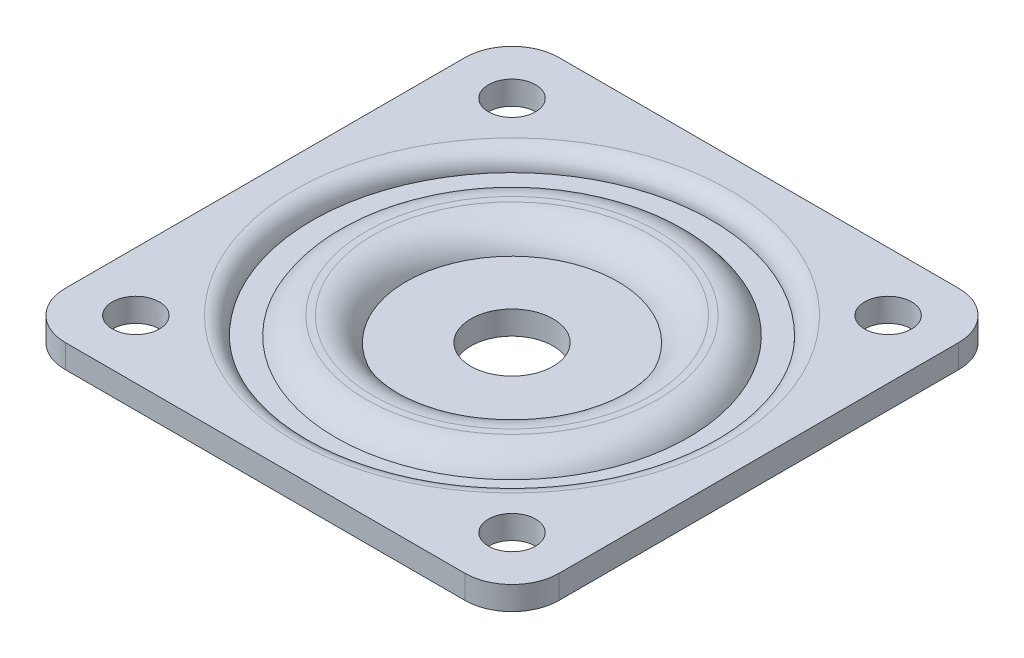
from build123d import *

# Parameters (mm, degrees)
ESBO_O9_W                  = 42
ESBO_O9_H                  = 42
RESSALTO_EXTRUS_O1_DEPTH   = 4
ESBO_O10_R                 = 17
ESBO_O10_R_2               = 15
CORTE_EXTRUS_O1_DEPTH      = 1.5
FILETE1_R                  = 1.5
CORTE_EXTRUS_O2_START      = -2
ESBO_O11_W                 = 42
ESBO_O11_H                 = 42
ESBO_O11_R                 = 17
CORTE_EXTRUS_O2_DEPTH      = 2
FILETE2_R                  = 2
ESBO_O12_R                 = 9
CORTE_EXTRUS_O3_DEPTH      = 2
FILETE3_R                  = 3
ESBO_O13_R                 = 14
ESBO_O13_R_2               = 12
CORTE_EXTRUS_O4_DEPTH      = 2
FILETE4_R                  = 2
ESBO_O14_R                 = 3.5
CORTE_EXTRUS_O5_DEPTH      = 30.765752132
FURO_DE_DI_METRO_5_0_5_1_D = 4
FILETE5_R                  = 4


# Some blends are built 0.0001 mm under size
with BuildPart() as part:
    # Esboço9 → Ressalto-extrusão1 (new body)
    with BuildSketch(Plane(origin=(0, 0, 0), x_dir=(1, 0, 0), z_dir=(0, 1, 0))):
        Rectangle(ESBO_O9_W, ESBO_O9_H)
    extrude(amount=RESSALTO_EXTRUS_O1_DEPTH)

    # Esboço10 → Corte-extrusão1 (cut)
    with BuildSketch(Plane(origin=(0, 4, 0), x_dir=(1, 0, 0), z_dir=(0, 1, 0))):
        with Locations(Location((0, 0, 0), (0, 0, 270))):
            Circle(ESBO_O10_R)
        with Locations(Location((0, 0, 0), (0, 0, 270))):
            Circle(ESBO_O10_R_2, mode=Mode.SUBTRACT)
    extrude(amount=-CORTE_EXTRUS_O1_DEPTH, mode=Mode.SUBTRACT)

    # Filete1
    filete1_edges = [part.edges().sort_by_distance(p)[0] for p in [
        (0, 4, -17),
    ]]
    fillet(filete1_edges, radius=FILETE1_R - 0.0001)  # a hair under: the kernel refuses the full size

    # Esboço11 → Corte-extrusão2 (cut)
    with BuildSketch(Plane.XZ.offset(CORTE_EXTRUS_O2_START)):
        Rectangle(ESBO_O11_W, ESBO_O11_H)
        with Locations(Location((0, 0, 0), (0, 0, 270))):
            Circle(ESBO_O11_R, mode=Mode.SUBTRACT)
    extrude(amount=CORTE_EXTRUS_O2_DEPTH, mode=Mode.SUBTRACT)

    # Filete2
    filete2_edges = [part.edges().sort_by_distance(p)[0] for p in [
        (0, 0, 17),
    ]]
    fillet(filete2_edges, radius=FILETE2_R - 0.0001)  # a hair under: the kernel refuses the full size

    # Esboço12 → Corte-extrusão3 (cut)
    with BuildSketch(Plane(origin=(0, 4, 0), x_dir=(1, 0, 0), z_dir=(0, 1, 0))):
        with Locations(Location((0, 0, 0), (0, 0, 270))):
            Circle(ESBO_O12_R)
    extrude(amount=-CORTE_EXTRUS_O3_DEPTH, mode=Mode.SUBTRACT)

    # Filete3
    # the kernel refuses this fillet: 3 mm, written as the material it takes off along each edge
    with BuildSketch(Plane(origin=(0, 4, 0), x_dir=(0, 0, 1), z_dir=(-1, 0, 0))) as filete3_piece_1:
        with BuildLine():
            CenterArc((12.401923789, -3), FILETE3_R, 30, 60)
            Line((12.401923789, 0), (12.401923789, 0.06))
            Line((12.401923789, 0.06), (15, 0.06))
            Line((15, 0.06), (15.06, 0))
            ThreePointArc((15.06, 0), (15.06, -0.75), (15.051961524, -1.47))
            Line((15.051961524, -1.47), (15, -1.5))
        make_face()
    revolve(axis=Axis((0, 4, 0), (0, 1, 0)), mode=Mode.SUBTRACT)
    with BuildSketch(Plane(origin=(0, 4, 0), x_dir=(0, 0, 1), z_dir=(-1, 0, 0))) as filete3_piece_2:
        with BuildLine():
            CenterArc((11.828427125, -3), FILETE3_R, 90, 70.528779366)
            Line((9, -2), (8.943431458, -1.98))
            ThreePointArc((8.943431458, -1.98), (8.94, -1), (8.94, 0))
            Line((8.94, 0), (9, 0.06))
            Line((9, 0.06), (11.828427125, 0.06))
            Line((11.828427125, 0.06), (11.828427125, 0))
        make_face()
    revolve(axis=Axis((0, 4, 0), (0, 1, 0)), mode=Mode.SUBTRACT)

    # Esboço13 → Corte-extrusão4 (cut)
    with BuildSketch(Plane.XZ):
        with Locations(Location((0, 0, 0), (0, 0, 270))):
            Circle(ESBO_O13_R)
        with Locations(Location((0, 0, 0), (0, 0, 270))):
            Circle(ESBO_O13_R_2, mode=Mode.SUBTRACT)
    extrude(amount=-CORTE_EXTRUS_O4_DEPTH, mode=Mode.SUBTRACT)

    # Filete4
    # the kernel refuses this fillet: 2 mm, written as the material it takes off along each edge
    with BuildSketch(Plane(origin=(0, 0, 0), x_dir=(0, 0, -1), z_dir=(-1, 0, 0))) as filete4_piece_1:
        with BuildLine():
            CenterArc((16, -1.732108539), FILETE4_R, 119.996692082, 60.003307918)
            Line((14, -1.732108539), (13.96, -1.732108539))
            Line((13.96, -1.732108539), (13.96, 0))
            Line((13.96, 0), (14, 0.04))
            ThreePointArc((14, 0.04), (14.50005, 0.04), (14.980102, 0.034642171))
            Line((14.980102, 0.034642171), (15.0001, 0))
        make_face()
    revolve(axis=Axis((0, 0, 0), (0, -1, 0)), mode=Mode.SUBTRACT)
    with BuildSketch(Plane(origin=(0, 0, 0), x_dir=(0, 0, -1), z_dir=(-1, 0, 0))) as filete4_piece_2:
        with BuildLine():
            CenterArc((12 - FILETE4_R, -FILETE4_R), FILETE4_R, 0, 90)
            Line((12 - FILETE4_R, 0), (12 - FILETE4_R, FILETE4_R * 0.02))
            Line((12 - FILETE4_R, FILETE4_R * 0.02), (12 + FILETE4_R * 0.02, FILETE4_R * 0.02))
            Line((12 + FILETE4_R * 0.02, FILETE4_R * 0.02), (12 + FILETE4_R * 0.02, -FILETE4_R))
            Line((12 + FILETE4_R * 0.02, -FILETE4_R), (12, -FILETE4_R))
        make_face()
    revolve(axis=Axis((0, 0, 0), (0, -1, 0)), mode=Mode.SUBTRACT)

    # Esboço14 → Corte-extrusão5 (cut, through all)
    with BuildSketch(Plane(origin=(0, 2, 0), x_dir=(1, 0, 0), z_dir=(0, 1, 0))):
        with Locations(Location((0, 0, 0), (0, 0, 270))):
            Circle(ESBO_O14_R)
    extrude(amount=-CORTE_EXTRUS_O5_DEPTH, mode=Mode.SUBTRACT)

    # Furo de diâmetro Ø5.0 (5)1 (through all)
    with Locations(Plane(origin=(0, 4, 0), x_dir=(1, 0, 0), z_dir=(0, 1, 0))):
        with Locations((-16, -16), (-16, 16), (16, 16), (16, -16)):
            Hole(FURO_DE_DI_METRO_5_0_5_1_D / 2)

    # Filete5
    filete5_edges = [part.edges().sort_by_distance(p)[0] for p in [
        (-21, 3, -21),
        (21, 3, -21),
        (21, 3, 21),
        (-21, 3, 21),
    ]]
    fillet(filete5_edges, radius=FILETE5_R)


solid = part.part
